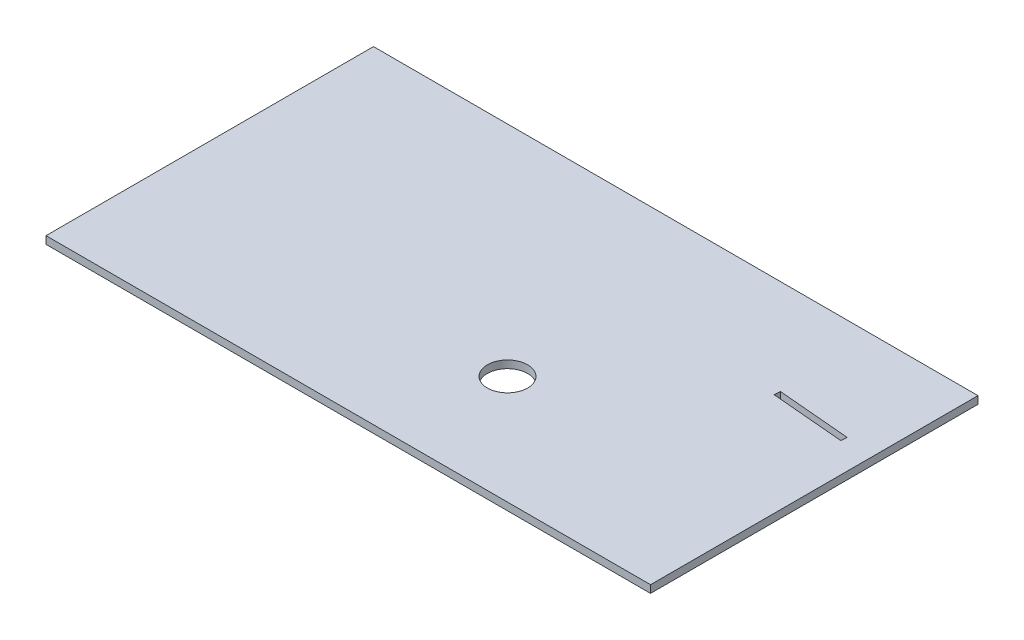
from build123d import *

# Parameters (mm, degrees)
BOSS_EXTRUDE1_DEPTH    = 50.8
SKETCH4_W              = 1524
SKETCH4_H              = 825.5
BOSS_EXTRUDE2_DEPTH    = 19.05
F_20_0MM_DOWEL_HOLE1_D = 101.6
SKETCH8_W              = 1.5875
SKETCH8_H              = 50.8
BOSS_EXTRUDE3_DEPTH    = 204
CUT_EXTRUDE1_DEPTH     = 1048.186527675


with BuildPart() as part:
    # Sketch3 → Boss-Extrude1 (new body)
    with BuildSketch(Plane(origin=(0, 0, 0), x_dir=(1, 0, 0), z_dir=(0, 1, 0))):
        with BuildLine():
            Line((-524, 0), (-525.5875, 0))
            ThreePointArc((-525.5875, 0), (-255.243310314, 459.448661655), (277.677694458, 446.248045549))
            Line((277.677694458, 446.248045549), (277.677694458, 444.377202386))
            ThreePointArc((277.677694458, 444.377202386), (-254.040241009, 458.300726541), (-524, 0))
        make_face()
    extrude(amount=BOSS_EXTRUDE1_DEPTH)

    # Sketch4 → Boss-Extrude2 (add)
    with BuildSketch(Plane(origin=(0, 50.8, 0), x_dir=(1, 0, 0), z_dir=(0, 1, 0))):
        with Locations((-127, 138.338)):
            Rectangle(SKETCH4_W, SKETCH4_H)
    extrude(amount=BOSS_EXTRUDE2_DEPTH)

    # Ø20.0mm Dowel Hole1 (through all)
    with Locations(Plane(origin=(0, 50.8, 0), x_dir=(-1, 0, 0), z_dir=(0, -1, 0))):
        with Locations((0, 0)):
            Hole(F_20_0MM_DOWEL_HOLE1_D / 2)

    # Sketch8 → Boss-Extrude3 (add)
    with BuildSketch(Plane.XY):
        with Locations((-524.79375, 25.4)):
            Rectangle(SKETCH8_W, SKETCH8_H)
    extrude(amount=BOSS_EXTRUDE3_DEPTH)

    # Sketch9 → Cut-Extrude1 (cut, through all)
    with BuildSketch(Plane(origin=(0, 50.8, 0), x_dir=(-1, 0, 0), z_dir=(0, -1, 0))):
        Polygon((-377.011316994, 311.06673288), (-561.307336141, 294.942920471), (-560, 280), (-375.703980853, 296.123812408), align=None)
    extrude(amount=-CUT_EXTRUDE1_DEPTH, mode=Mode.SUBTRACT)


solid = part.part
